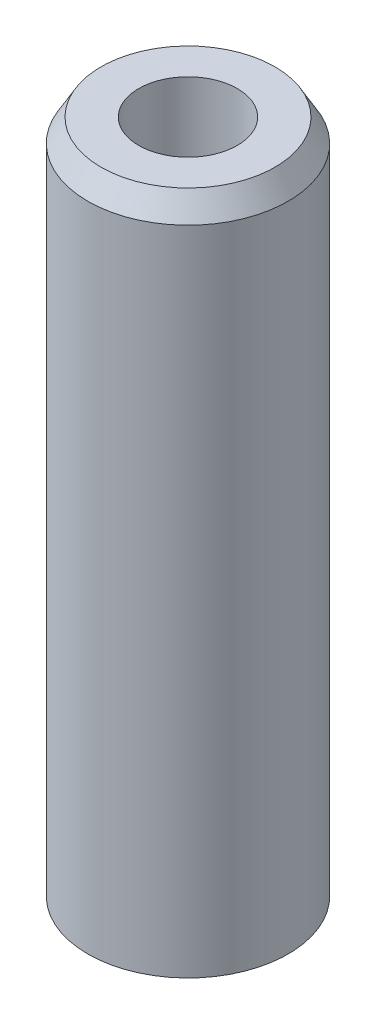
from build123d import *
from OCP.BRepFilletAPI import BRepFilletAPI_MakeChamfer

# Parameters (mm, degrees)
SKETCH1_R           = 15
BOSS_EXTRUDE1_DEPTH = 102.994844138
SKETCH2_R           = 7.380519462
CUT_EXTRUDE1_DEPTH  = 106.15673026
CHAMFER1_SIZE       = 3.425620227
CHAMFER1_SIZE2      = 1.97778276


with BuildPart() as part:
    # Sketch1 → Boss-Extrude1 (new body)
    with BuildSketch(Plane(origin=(0, 0, 0), x_dir=(1, 0, 0), z_dir=(0, 1, 0))):
        Circle(SKETCH1_R)
    extrude(amount=BOSS_EXTRUDE1_DEPTH)

    # Sketch2 → Cut-Extrude1 (cut, through all)
    with BuildSketch(Plane(origin=(0, 0, 0), x_dir=(1, 0, 0), z_dir=(0, 1, 0))):
        Circle(SKETCH2_R)
    extrude(amount=CUT_EXTRUDE1_DEPTH, mode=Mode.SUBTRACT)

    # Chamfer1: one chamfer whose edges measure the first distance from different faces: ONE call of the kernel's chamfer builder (chamfer() names one face for all edges)
    chamfer1_edges_1 = [part.edges().sort_by_distance(p)[0] for p in [
        (-15, 102.994844138, 0),
    ]]
    chamfer1_side_1 = [part.faces().sort_by_distance(p)[0] for p in [
        (-15, 51.497422069, 0),
    ]]
    chamfer1_edges_2 = [part.edges().sort_by_distance(p)[0] for p in [
        (-15, 0, 0),
    ]]
    chamfer1_side_2 = [part.faces().sort_by_distance(p)[0] for p in [
        (-14.575735931, 0, 0),
    ]]
    chamfer1 = BRepFilletAPI_MakeChamfer(part.part.solid().wrapped)
    for e in chamfer1_edges_1:
        chamfer1.Add(CHAMFER1_SIZE, CHAMFER1_SIZE2, e.wrapped, chamfer1_side_1[0].wrapped)  # the first distance lies on this face
    for e in chamfer1_edges_2:
        chamfer1.Add(CHAMFER1_SIZE, CHAMFER1_SIZE2, e.wrapped, chamfer1_side_2[0].wrapped)  # the first distance lies on this face
    add(Compound.cast(chamfer1.Shape()), mode=Mode.REPLACE)


solid = part.part
